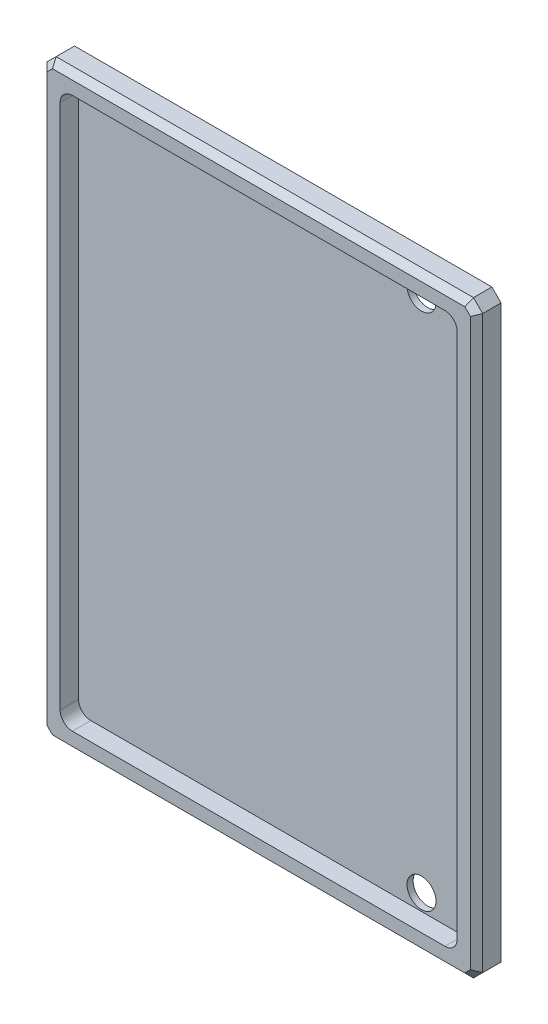
from build123d import *

# Parameters (mm, degrees)
SKETCH1_W                 = 225.425
SKETCH1_H                 = 304.8
BOSS_EXTRUDE1_DEPTH       = 12.7
CUT_EXTRUDE1_DEPTH        = 9.525
SKETCH4_R                 = 7.5
CUT_EXTRUDE3_DEPTH        = 190.976729249
M4X0_7_TAPPED_HOLE1_D     = 3.3
M4X0_7_TAPPED_HOLE1_DEPTH = 5.4
M4X0_7_TAPPED_HOLE1_TIP   = 0.991420021
CHAMFER1_SIZE             = 4.7625
CHAMFER2_SIZE             = 3.175


with BuildPart() as part:
    # Sketch1 → Boss-Extrude1 (new body)
    with BuildSketch(Plane.XY):
        Rectangle(SKETCH1_W, SKETCH1_H)
    extrude(amount=BOSS_EXTRUDE1_DEPTH)

    # Sketch2 → Cut-Extrude1 (cut)
    with BuildSketch(Plane.XY.offset(12.7)):
        with BuildLine():
            Line((96.3625, -142.4), (-96.3625, -142.4))
            ThreePointArc((-96.3625, -142.4), (-100.852628061, -140.540128061), (-102.7125, -136.05))
            Line((-102.7125, -136.05), (-102.7125, 136.05))
            ThreePointArc((-102.7125, 136.05), (-100.852628061, 140.540128061), (-96.3625, 142.4))
            Line((-96.3625, 142.4), (96.3625, 142.4))
            ThreePointArc((96.3625, 142.4), (100.852628061, 140.540128061), (102.7125, 136.05))
            Line((102.7125, 136.05), (102.7125, -136.05))
            ThreePointArc((102.7125, -136.05), (100.852628061, -140.540128061), (96.3625, -142.4))
        make_face()
    extrude(amount=-CUT_EXTRUDE1_DEPTH, mode=Mode.SUBTRACT)

    # Sketch4 → Cut-Extrude3 (cut, through all)
    with BuildSketch(Plane(origin=(0, 0, 0), x_dir=(-1, 0, 0), z_dir=(0, 0, -1))):
        with Locations((-74.7125, -134.05)):
            Circle(SKETCH4_R)
        with Locations((-74.7125, 134.05)):
            Circle(SKETCH4_R)
    extrude(amount=-CUT_EXTRUDE3_DEPTH, mode=Mode.SUBTRACT)

    # M4x0.7 Tapped Hole1
    with Locations(Plane(origin=(0, 0, 0), x_dir=(-1, 0, 0), z_dir=(0, 0, -1))):
        with Locations((109.5375, -113.6), (109.5375, 113.6)):
            Hole(M4X0_7_TAPPED_HOLE1_D / 2, depth=M4X0_7_TAPPED_HOLE1_DEPTH)
            with Locations((0, 0, -(M4X0_7_TAPPED_HOLE1_DEPTH + M4X0_7_TAPPED_HOLE1_TIP / 2))):  # 118° drill point
                Cone(0, M4X0_7_TAPPED_HOLE1_D / 2, M4X0_7_TAPPED_HOLE1_TIP, mode=Mode.SUBTRACT)

    # Chamfer1
    chamfer1_edges = [part.edges().sort_by_distance(p)[0] for p in [
        (-112.7125, 152.4, 6.35),
        (112.7125, 152.4, 6.35),
        (112.7125, -152.4, 6.35),
        (-112.7125, -152.4, 6.35),
    ]]
    chamfer(chamfer1_edges, length=CHAMFER1_SIZE)

    # Chamfer2
    chamfer2_edges = [part.edges().sort_by_distance(p)[0] for p in [
        (110.33125, -150.01875, 12.7),
        (112.7125, 0, 12.7),
        (110.33125, 150.01875, 12.7),
        (0, 152.4, 12.7),
        (-110.33125, 150.01875, 12.7),
        (-112.7125, 0, 12.7),
        (-110.33125, -150.01875, 12.7),
        (0, -152.4, 12.7),
    ]]
    chamfer(chamfer2_edges, length=CHAMFER2_SIZE)


solid = part.part
